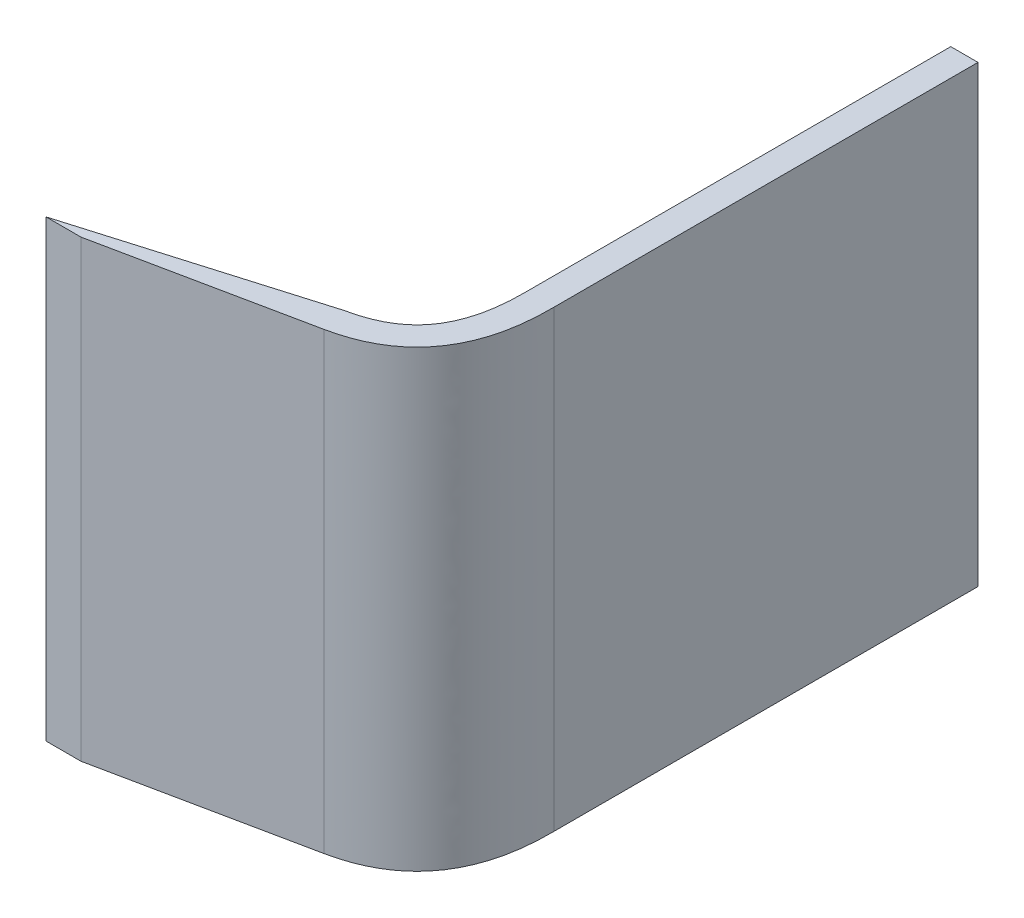
from build123d import *

# Parameters (mm, degrees)
BOSS_EXTRUDE1_DEPTH = 50


with BuildPart() as part:
    # Sketch1 → Boss-Extrude1 (new body)
    with BuildSketch(Plane(origin=(0, 0, 0), x_dir=(1, 0, 0), z_dir=(0, 1, 0))):
        with BuildLine():
            Line((3, 46.72), (0, 46.72))
            Line((0, 46.72), (0, 0))
            Line((0, 0), (0.000186337, -0.03343628))
            add(Edge.make_bspline(
                [(0.000186337, -0.03343628), (0.005239929, -0.486831056), (-0.009475768, -1.417335062), (-0.137351147, -3.087884204), (-0.471550564, -4.947811199), (-1.116797216, -6.782204669), (-1.973725508, -8.269549477), (-3.042888675, -9.477251715), (-4.37173122, -10.472028768), (-5.764833241, -11.143024266), (-7.059525511, -11.570636997), (-7.798848397, -11.751181425), (-8.16140534, -11.826136958)],
                knots=[0, 0, 0, 0, 0.0625, 0.125, 0.25, 0.375, 0.5, 0.625, 0.75, 0.875, 0.9375, 1, 1, 1, 1], degree=3))
            Line((-8.16140534, -11.826136958), (-33.586790943, -19.341198123))
            Line((-33.586790943, -19.341198123), (-29.724787296, -19.341198123))
            Line((-29.724787296, -19.341198123), (-7.554025616, -14.764008615))
            add(Edge.make_bspline(
                [(3, 0), (3.139918652, -12.553127515), (-7.554025616, -14.764008615)],
                knots=[0, 0, 0, 1, 1, 1], degree=2))
            Line((3, 0), (3, 46.72))
        make_face()
    extrude(amount=BOSS_EXTRUDE1_DEPTH)


solid = part.part
